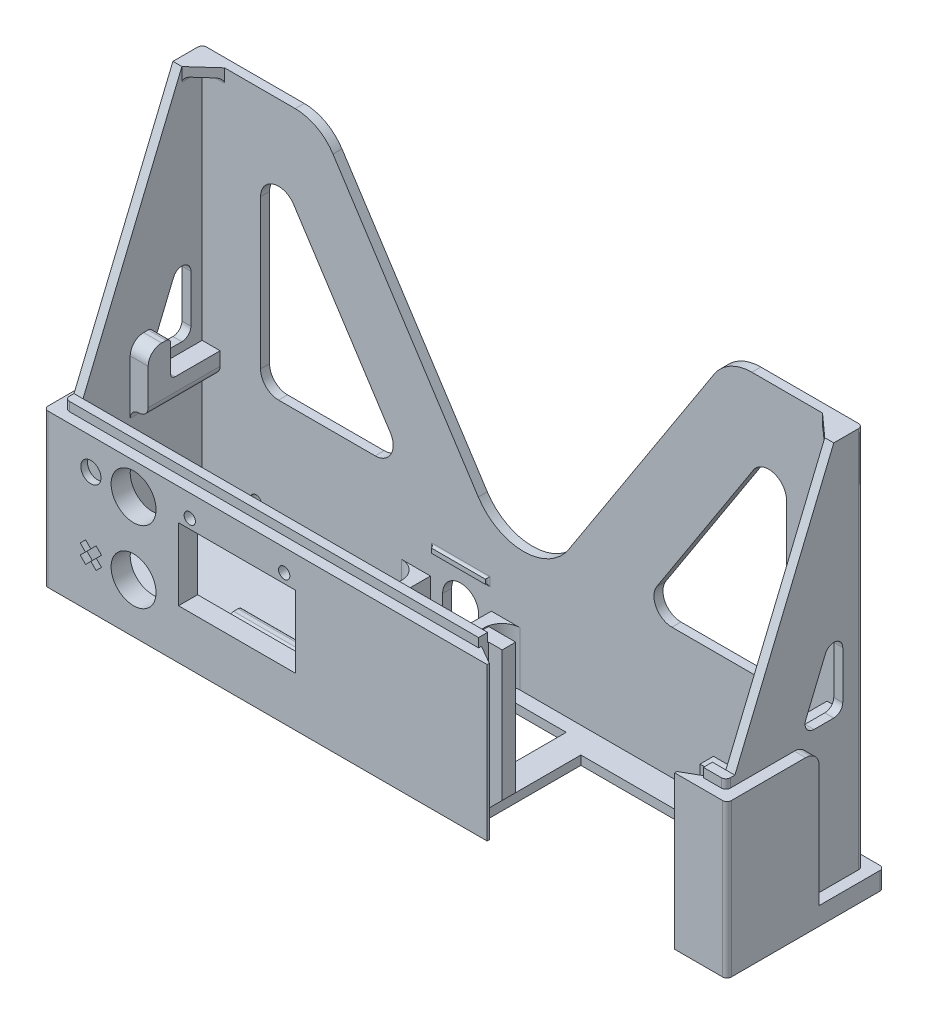
from build123d import *

# Parameters (mm, degrees)
ESBO_O1_W                     = 152
ESBO_O1_H                     = 35
RESSALTO_EXTRUS_O1_DEPTH      = 2
ESBO_O3_W                     = 152
ESBO_O3_H                     = 35
ESBO_O3_W_2                   = 144
ESBO_O3_H_2                   = 27
RESSALTO_EXTRUS_O2_DEPTH      = 32
ESBO_O5_W                     = 152
ESBO_O5_H                     = 14.5
CORTE_EXTRUS_O1_DEPTH         = 30
FILETE2_R                     = 3
ESBO_O6_W                     = 147
ESBO_O6_H                     = 30.5
ESBO_O6_W_2                   = 143
ESBO_O6_H_2                   = 26.5
RESSALTO_EXTRUS_O3_DEPTH      = 87
FILETE3_R                     = 1
ESBO_O7_R                     = 5
ESBO_O7_R_2                   = 1.25
ESBO_O7_W                     = 26
ESBO_O7_H                     = 16
CORTE_EXTRUS_O2_DEPTH         = 4.25
ESBO_O8_R                     = 2.25
CORTE_EXTRUS_O3_DEPTH         = 1.5
CORTE_EXTRUS_O5_START         = -89
CORTE_EXTRUS_O5_DEPTH         = 89
CORTE_EXTRUS_O6_DEPTH         = 55
ESBO_O12_W                    = 14
ESBO_O12_H                    = 19.5
ESBO_O12_W_2                  = 8
ESBO_O12_H_2                  = 6
CORTE_EXTRUS_O7_DEPTH         = 16
FILETE4_R                     = 4
RESSALTO_EXTRUS_O4_DEPTH      = 12
ESBO_O16_W                    = 12
ESBO_O16_H                    = 1
RESSALTO_EXTRUS_O5_DEPTH      = 0.5
FILETE7_R                     = 0.5
RESSALTO_EXTRUS_O6_DEPTH      = 18
RESSALTO_EXTRUS_O6_DEPTH_BACK = 1
RESSALTO_EXTRUS_O6_START      = 4
CORTE_EXTRUS_O9_DEPTH         = 176.790358097
CORTE_EXTRUS_O9_DEPTH_BACK    = 176.790358097
ESBO_O22_R                    = 1.25
CORTE_EXTRUS_O10_DEPTH        = 179.803138955
RESSALTO_EXTRUS_O8_DEPTH      = 2
FILETE8_R                     = 1
RESSALTO_EXTRUS_O9_DEPTH      = 4
FILETE10_R                    = 2
RESSALTO_EXTRUS_O10_START     = -4
RESSALTO_EXTRUS_O10_DEPTH     = 4
FILETE11_R                    = 2
FILETE12_R                    = 10
RESSALTO_EXTRUS_O11_DEPTH     = 32
CHANFRO1_SIZE                 = 3
FILETE13_R                    = 1
FILETE14_R                    = 1


with BuildPart() as part:
    # Esboço1 → Ressalto-extrusão1 (new body)
    with BuildSketch(Plane(origin=(0, 0, 0), x_dir=(1, 0, 0), z_dir=(0, 1, 0))):
        with Locations((76, 17.5)):
            Rectangle(ESBO_O1_W, ESBO_O1_H)
    extrude(amount=RESSALTO_EXTRUS_O1_DEPTH)

    # Esboço3 → Ressalto-extrusão2 (add)
    with BuildSketch(Plane(origin=(0, 2, 0), x_dir=(1, 0, 0), z_dir=(0, 1, 0))):
        with Locations((76, 17.5)):
            Rectangle(ESBO_O3_W, ESBO_O3_H)
        with Locations((76, 17.5)):
            Rectangle(ESBO_O3_W_2, ESBO_O3_H_2, mode=Mode.SUBTRACT)
    extrude(amount=RESSALTO_EXTRUS_O2_DEPTH)

    # Esboço5 → Corte-extrusão1 (cut)
    with BuildSketch(Plane(origin=(0, 34, 0), x_dir=(1, 0, 0), z_dir=(0, 1, 0))):
        with Locations((76, 27.75)):
            Rectangle(ESBO_O5_W, ESBO_O5_H)
    extrude(amount=-CORTE_EXTRUS_O1_DEPTH, mode=Mode.SUBTRACT)

    # Filete2
    filete2_edges = [part.edges().sort_by_distance(p)[0] for p in [
        (150, 34, -20.5),
        (2, 34, -20.5),
    ]]
    fillet(filete2_edges, radius=FILETE2_R)

    # Esboço6 → Ressalto-extrusão3 (add)
    with BuildSketch(Plane(origin=(0, 2, 0), x_dir=(1, 0, 0), z_dir=(0, 1, 0))):
        with Locations((76, 17.5)):
            Rectangle(ESBO_O6_W, ESBO_O6_H)
        with Locations((76, 17.5)):
            Rectangle(ESBO_O6_W_2, ESBO_O6_H_2, mode=Mode.SUBTRACT)
    extrude(amount=RESSALTO_EXTRUS_O3_DEPTH)

    # Filete3
    filete3_edges = [part.edges().sort_by_distance(p)[0] for p in [
        (0, 2, -35),
        (152, 2, -35),
        (152, 17, 0),
        (0, 17, 0),
        (149.5, 46.5, -32.75),
        (149.5, 61.5, -2.25),
        (2.5, 61.5, -2.25),
        (2.5, 46.5, -32.75),
    ]]
    fillet(filete3_edges, radius=FILETE3_R)

    # Esboço7 → Corte-extrusão2 (cut)
    with BuildSketch(Plane.XY):
        with Locations((20, 27)):
            Circle(ESBO_O7_R)
        with Locations((20, 11)):
            Circle(ESBO_O7_R)
        with Locations((32.5, 29.1)):
            Circle(ESBO_O7_R_2)
        with Locations((53.5, 29.1)):
            Circle(ESBO_O7_R_2)
        with Locations((43, 19)):
            Rectangle(ESBO_O7_W, ESBO_O7_H)
    extrude(amount=-CORTE_EXTRUS_O2_DEPTH, mode=Mode.SUBTRACT)

    # Esboço8 → Corte-extrusão3 (cut)
    with BuildSketch(Plane.XY):
        with Locations((10.5, 27)):
            Circle(ESBO_O8_R)
        Polygon((9.333273916, 13.368807769), (10.500000059, 12.202081537), (11.666726239, 13.368807692), (12.868807717, 12.16672619), (11.702081503, 11), (12.868807679, 9.833273734), (11.666726084, 8.631192231), (10.499999941, 9.797918463), (9.333273761, 8.631192308), (8.131192283, 9.83327381), (9.297918497, 11), (8.131192321, 12.166726266), align=None)
    extrude(amount=-CORTE_EXTRUS_O3_DEPTH, mode=Mode.SUBTRACT)

    # Esboço10 → Corte-extrusão5 (cut)
    with BuildSketch(Plane.XZ.offset(CORTE_EXTRUS_O5_START)):
        Polygon((139.5, 0), (99.5, 0), (98.633974596, 0), (98.633974596, -0.5), (94.5, -2.886751346), (94.5, -25), (144.5, -25), (144.5, -2.886751346), (140.366025404, -0.5), (140.366025404, 0), align=None)
    extrude(amount=CORTE_EXTRUS_O5_DEPTH, mode=Mode.SUBTRACT)

    # Esboço11 → Corte-extrusão6 (cut)
    with BuildSketch(Plane(origin=(0, 89, 0), x_dir=(1, 0, 0), z_dir=(0, 1, 0))):
        Polygon((94.5, 2.886751346), (94.5, 2.25), (95.602885683, 2.25), align=None)
        Polygon((143.397114317, 2.25), (144.5, 2.886751346), (144.5, 2.25), align=None)
    extrude(amount=-CORTE_EXTRUS_O6_DEPTH, mode=Mode.SUBTRACT)

    # Esboço12 → Corte-extrusão7 (cut)
    with BuildSketch(Plane.XZ):
        with Locations((81.5, -18)):
            Rectangle(ESBO_O12_W, ESBO_O12_H)
        with BuildLine():
            Line((56, -17.25), (56, -12.25))
            ThreePointArc((56, -12.25), (62, -8.25), (68, -12.25))
            Line((68, -12.25), (68, -17.25))
            ThreePointArc((68, -17.25), (62, -21.25), (56, -17.25))
        make_face()
        with Locations((62, -32)):
            Rectangle(ESBO_O12_W_2, ESBO_O12_H_2)
    extrude(amount=-CORTE_EXTRUS_O7_DEPTH, mode=Mode.SUBTRACT)

    # Filete4
    filete4_edges = [part.edges().sort_by_distance(p)[0] for p in [
        (66, 16, -31.75),
        (58, 16, -31.75),
    ]]
    fillet(filete4_edges, radius=FILETE4_R - 0.0001)  # a hair under: the kernel refuses the full size

    # Esboço15 → Ressalto-extrusão4 (add)
    with BuildSketch(Plane(origin=(0, 2, 0), x_dir=(1, 0, 0), z_dir=(0, 1, 0))):
        with BuildLine():
            Line((68.619154519, 22.35), (67.119154519, 23.85))
            Line((67.119154519, 23.85), (67.119154519, 24.75))
            Line((67.119154519, 24.75), (68.823336518, 24.75))
            Line((68.823336518, 24.75), (68.823336518, 30.75))
            Line((68.823336518, 30.75), (71.223336518, 30.75))
            Line((71.223336518, 30.75), (75.223336518, 30.75))
            ThreePointArc((75.223336518, 30.75), (72.394909394, 29.578427125), (71.223336518, 26.75))
            Line((71.223336518, 26.75), (71.223336518, 22.35))
            Line((71.223336518, 22.35), (68.619154519, 22.35))
        make_face()
        with BuildLine():
            Line((55.287058032, 24.75), (55.287058032, 30.75))
            Line((55.287058032, 30.75), (52.887058032, 30.75))
            Line((52.887058032, 30.75), (48.887058032, 30.75))
            ThreePointArc((48.887058032, 30.75), (51.715485157, 29.578427125), (52.887058032, 26.75))
            Line((52.887058032, 26.75), (52.887058032, 22.35))
            Line((52.887058032, 22.35), (55.491240032, 22.35))
            Line((55.491240032, 22.35), (56.991240032, 23.85))
            Line((56.991240032, 23.85), (56.991240032, 24.75))
            Line((56.991240032, 24.75), (55.287058032, 24.75))
        make_face()
    extrude(amount=RESSALTO_EXTRUS_O4_DEPTH)

    # Esboço16 → Ressalto-extrusão5 (add)
    with BuildSketch(Plane.XY.offset(-30.75)):
        with Locations((62, 19.5)):
            Rectangle(ESBO_O16_W, ESBO_O16_H)
    extrude(amount=RESSALTO_EXTRUS_O5_DEPTH)

    # Filete7
    filete7_edges = [part.edges().sort_by_distance(p)[0] for p in [
        (56, 19.5, -30.75),
        (68, 19.5, -30.75),
        (62, 20, -30.75),
        (62, 19, -30.75),
    ]]
    fillet(filete7_edges, radius=FILETE7_R - 0.0001)  # a hair under: the kernel refuses the full size

    # Esboço18 → Ressalto-extrusão6 (add, two sides: drawn at the far end of the back side and taken through both)
    with BuildSketch(Plane(origin=(30, 0, 0), x_dir=(0, 0, -1), z_dir=(1, 0, 0)).offset(RESSALTO_EXTRUS_O6_START - RESSALTO_EXTRUS_O6_DEPTH_BACK)):
        with BuildLine():
            Line((4.25, 3.8), (7.25, 3.8))
            ThreePointArc((7.25, 3.8), (7.957106781, 4.092893219), (8.25, 4.8))
            Line((8.25, 4.8), (8.25, 5.8))
            ThreePointArc((8.25, 5.8), (8.542893219, 6.507106781), (9.25, 6.8))
            Line((9.25, 6.8), (10.25, 6.8))
            ThreePointArc((10.25, 6.8), (10.957106781, 6.507106781), (11.25, 5.8))
            Line((11.25, 5.8), (11.25, 2))
            Line((11.25, 2), (4.25, 2))
            Line((4.25, 2), (4.25, 3.8))
        make_face()
    extrude(amount=RESSALTO_EXTRUS_O6_DEPTH + RESSALTO_EXTRUS_O6_DEPTH_BACK)

    # Esboço20 → Corte-extrusão9 (cut, two sides: drawn at the far end of the back side and taken through both)
    with BuildSketch(Plane.ZY.offset(-147.5).offset(-CORTE_EXTRUS_O9_DEPTH_BACK)):
        Polygon((-2.25, 89), (-2.25, 36), (-4.25, 36), (-26.25, 89), align=None)
        with BuildLine():
            Line((-28.25, 48.569893746), (-28.25, 38))
            ThreePointArc((-28.25, 38), (-27.664213562, 36.585786438), (-26.25, 36))
            Line((-26.25, 36), (-21.862496936, 36))
            ThreePointArc((-21.862496936, 36), (-20.199140286, 36.889484509), (-20.015313609, 38.766755343))
            Line((-20.015313609, 38.766755343), (-24.402816673, 49.336649089))
            ThreePointArc((-24.402816673, 49.336649089), (-26.640917732, 50.531317547), (-28.25, 48.569893746))
        make_face()
    extrude(amount=CORTE_EXTRUS_O9_DEPTH + CORTE_EXTRUS_O9_DEPTH_BACK, mode=Mode.SUBTRACT)

    # Esboço22 → Corte-extrusão10 (cut, through all)
    with BuildSketch(Plane.XY.offset(-30.75)):
        with BuildLine():
            Line((86.071558039, 34.5479644), (121.344139246, 89))
            Line((121.344139246, 89), (30.655860754, 89))
            Line((30.655860754, 89), (65.928441961, 34.5479644))
            ThreePointArc((65.928441961, 34.5479644), (76, 29.072051973), (86.071558039, 34.5479644))
        make_face()
        with BuildLine():
            ThreePointArc((127.142813987, 70.361637252), (131.633855358, 72.022873097), (134.5, 68.186941394))
            Line((134.5, 68.186941394), (134.5, 35))
            ThreePointArc((134.5, 35), (133.328427125, 32.171572875), (130.5, 31))
            Line((130.5, 31), (109.002381547, 31))
            ThreePointArc((109.002381547, 31), (105.488211415, 33.089343494), (105.645195534, 37.174695858))
            Line((105.645195534, 37.174695858), (127.142813987, 70.361637252))
        make_face()
        with BuildLine():
            Line((42.997618453, 31), (21.5, 31))
            ThreePointArc((21.5, 31), (18.671572875, 32.171572875), (17.5, 35))
            Line((17.5, 35), (17.5, 68.186941394))
            ThreePointArc((17.5, 68.186941394), (20.366144642, 72.022873097), (24.857186013, 70.361637252))
            Line((24.857186013, 70.361637252), (46.354804466, 37.174695858))
            ThreePointArc((46.354804466, 37.174695858), (46.511788585, 33.089343494), (42.997618453, 31))
        make_face()
        with Locations((16.5, 9)):
            Circle(ESBO_O22_R)
        with Locations((135.5, 9)):
            Circle(ESBO_O22_R)
    extrude(amount=-CORTE_EXTRUS_O10_DEPTH, mode=Mode.SUBTRACT)

    # Esboço25 → Ressalto-extrusão8 (add)
    with BuildSketch(Plane(origin=(0, 89, 0), x_dir=(1, 0, 0), z_dir=(0, 1, 0))):
        Polygon((147.5, 30.75), (142.5, 30.75), (147.5, 26.25), align=None)
        Polygon((4.5, 30.75), (9.5, 30.75), (4.5, 26.25), align=None)
    extrude(amount=-RESSALTO_EXTRUS_O8_DEPTH)

    # Filete8
    filete8_edges = [part.edges().sort_by_distance(p)[0] for p in [
        (147.5, 87, -28.5),
        (145, 87, -30.75),
        (4.5, 87, -28.5),
        (7, 87, -30.75),
    ]]
    fillet(filete8_edges, radius=FILETE8_R)

    # Esboço26 → Ressalto-extrusão9 (add)
    with BuildSketch(Plane.ZY.offset(-147.5)):
        with BuildLine():
            Line((-20.75, 34), (-30.75, 34))
            Line((-30.75, 34), (-30.75, 29))
            Line((-30.75, 29), (-14.75, 29))
            Line((-14.75, 29), (-14.75, 39))
            ThreePointArc((-14.75, 39), (-15.628679656, 41.121320344), (-17.75, 42))
            Line((-17.75, 42), (-18.75, 42))
            ThreePointArc((-18.75, 42), (-19.457106781, 41.707106781), (-19.75, 41))
            Line((-19.75, 41), (-19.75, 35))
            ThreePointArc((-19.75, 35), (-20.042893219, 34.292893219), (-20.75, 34))
        make_face()
    extrude(amount=RESSALTO_EXTRUS_O9_DEPTH)

    # Filete10
    filete10_edges = [part.edges().sort_by_distance(p)[0] for p in [
        (147.5, 29, -22.75),
    ]]
    fillet(filete10_edges, radius=FILETE10_R)
    filete10_2_edges = [part.edges().sort_by_distance(p)[0] for p in [
        (143.5, 29, -22.75),
    ]]
    fillet(filete10_2_edges, radius=FILETE10_R - 0.0001)  # a hair under: the kernel refuses the full size

    # Esboço27 → Ressalto-extrusão10 (add)
    with BuildSketch(Plane(origin=(4.5, 0, -4.5), x_dir=(0, 0, 1), z_dir=(-1, 0, 0)).offset(RESSALTO_EXTRUS_O10_START)):
        with BuildLine():
            Line((-26.25, 34), (-16.25, 34))
            ThreePointArc((-16.25, 34), (-15.542893219, 34.292893219), (-15.25, 35))
            Line((-15.25, 35), (-15.25, 41))
            ThreePointArc((-15.25, 41), (-14.957106781, 41.707106781), (-14.25, 42))
            Line((-14.25, 42), (-13.25, 42))
            ThreePointArc((-13.25, 42), (-11.128679656, 41.121320344), (-10.25, 39))
            Line((-10.25, 39), (-10.25, 29))
            Line((-10.25, 29), (-26.25, 29))
            Line((-26.25, 29), (-26.25, 34))
        make_face()
    extrude(amount=RESSALTO_EXTRUS_O10_DEPTH)

    # Filete11
    filete11_edges = [part.edges().sort_by_distance(p)[0] for p in [
        (4.5, 29, -22.75),
    ]]
    fillet(filete11_edges, radius=FILETE11_R)
    filete11_2_edges = [part.edges().sort_by_distance(p)[0] for p in [
        (8.5, 29, -22.75),
    ]]
    fillet(filete11_2_edges, radius=FILETE11_R - 0.0001)  # a hair under: the kernel refuses the full size

    # Filete12
    filete12_edges = [part.edges().sort_by_distance(p)[0] for p in [
        (121.344139246, 89, -31.75),
        (30.655860754, 89, -31.75),
    ]]
    fillet(filete12_edges, radius=FILETE12_R)

    # Esboço29 → Ressalto-extrusão11 (add)
    with BuildSketch(Plane(origin=(0, 2, 0), x_dir=(1, 0, 0), z_dir=(0, 1, 0))):
        Polygon((94.5, 4.25), (94.5, 4.5), (97.5, 4.5), (97.5, 7.5), (91.5, 7.5), (91.5, 4.25), align=None)
        Polygon((147.5, 4.25), (147.5, 7.5), (141.5, 7.5), (141.5, 4.5), (144.5, 4.5), (144.5, 4.25), align=None)
    extrude(amount=RESSALTO_EXTRUS_O11_DEPTH)

    # Chanfro1
    chanfro1_edges = [part.edges().sort_by_distance(p)[0] for p in [
        (97.5, 2, -6),
        (141.5, 2, -6),
    ]]
    chamfer(chanfro1_edges, length=CHANFRO1_SIZE - 0.0001)  # a hair under: the kernel refuses the full size

    # Filete13
    filete13_edges = [part.edges().sort_by_distance(p)[0] for p in [
        (91.5, 18, -4.25),
    ]]
    fillet(filete13_edges, radius=FILETE13_R)

    # Filete14
    filete14_edges = [part.edges().sort_by_distance(p)[0] for p in [
        (147.5, 18, -7.5),
    ]]
    fillet(filete14_edges, radius=FILETE14_R)


solid = part.part
